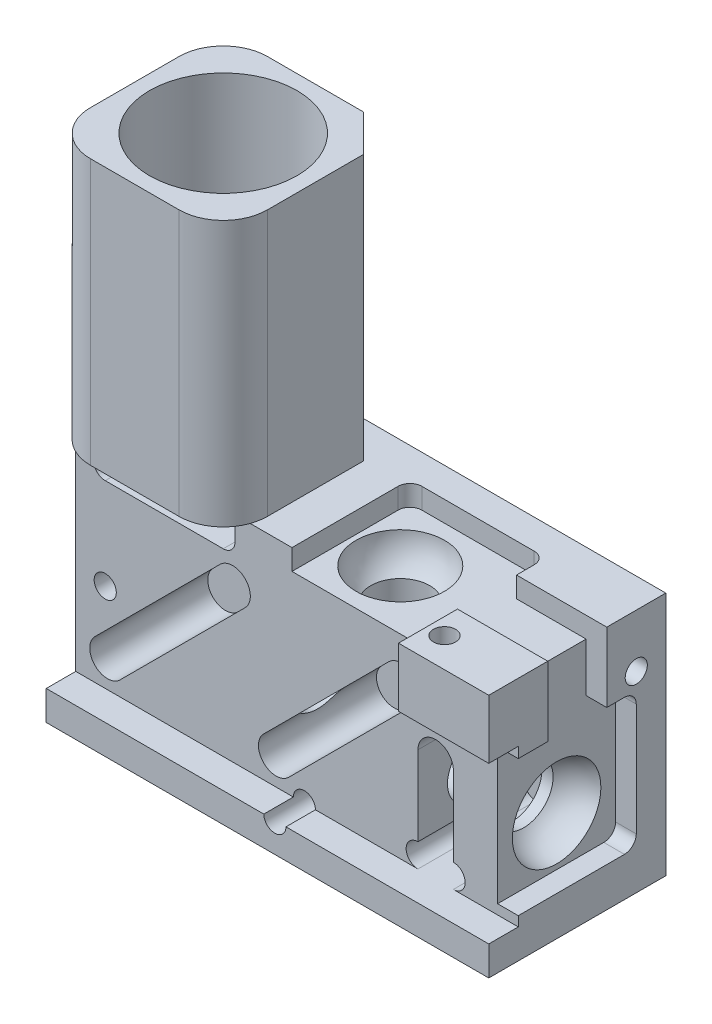
from build123d import *

# Parameters (mm, degrees)
SKETCH1_W                        = 15
SKETCH1_H                        = 6
MAIN_BODY_EXT_DEPTH              = 8.3
EMISSION_PATH_EXT_DEPTH          = 9
SKETCH3_R                        = 1.25
EMISSION_AND_GRIN_CUT_DEPTH      = 20.092931
SKETCH4_R                        = 1
DRUM_LENS_CUT_DEPTH              = 13
SKETCH41_R                       = 1
ADDTL_LIGHT_SOURCE_DEPTH         = 5
SKETCH5_W                        = 15
SKETCH5_H                        = 7.3
FILTERCOVER_CUT1_DEPTH           = 1
TOP_LED_SCREW_W                  = 3.06
TOP_LED_SCREW_H                  = 2
BOSS_EXTRUDE1_DEPTH              = 1
FILTERSET_CUT2_DEPTH             = 4
SKETCH10_R                       = 2.5
EMISSION_LENS_CUT_DEPTH          = 8.5
SKETCH15_R                       = 0.795
MAGNETS_CUT_DEPTH                = 0.9
SCREW_HOLES_CUT_DEPTH            = 20.507434
SCREW_HOLES_CUT_DEPTH_BACK       = 2.5
SKETCH18_R                       = 0.375
EXTERNAL_FILLET_1_R              = 1.5
VERTICAL_PATH_CUT_DEPTH          = 14.011149
VERTICAL_PATH_CUT_DEPTH_BACK     = 4
SKETCH28_R                       = 1.5
CUT_EXTRUDE_ORIGINAL_LIGHT_DEPTH = 0.7
CUT_EXTRUDE_ADDTL_LIGHT_DEPTH    = 0.7
SKETCH29_R                       = 0.375
SIDE_LED_SCREW_DEPTH             = 2.5
SKETCH32_W                       = 2
SKETCH32_H                       = 2.36
SIDE_WIRE_SLOT_CUT_DEPTH         = 0.7
SKETCH45_W                       = 2.36
SKETCH45_H                       = 2
TOP_LED_SLOT_DEPTH               = 0.7
CUT_EXTRUDE16_DEPTH              = 9
CUT_EXTRUDE17_REACH              = 13.945
SKETCH37_R                       = 2
SKETCH51_R                       = 0.375
TOP_LE_SCREW_DEPTH               = 2.1
NOTCH_EXTRUDE_DEPTH              = 2


with BuildPart() as part:
    # Sketch1 → Main Body Ext (new body)
    with BuildSketch(Plane(origin=(0, 0, 0), x_dir=(1, 0, 0), z_dir=(0, 1, 0))):
        Rectangle(SKETCH1_W, SKETCH1_H)
    extrude(amount=MAIN_BODY_EXT_DEPTH)

    # Sketch8 → Emission Path Ext (add)
    with BuildSketch(Plane(origin=(0, 8.3, 0), x_dir=(1, 0, 0), z_dir=(0, 1, 0))):
        Polygon((-2.75, 3), (-1.5, 1.75), (-1.5, -3), (-7.5, -3), (-7.5, 3), align=None)
    extrude(amount=EMISSION_PATH_EXT_DEPTH)

    # Sketch3 → Emission and Grin Cut (cut, through all)
    with BuildSketch(Plane.XZ):
        with Locations(Location((-4.5, 0, 0), (0, 0, 270))):
            Circle(SKETCH3_R)
    extrude(amount=-EMISSION_AND_GRIN_CUT_DEPTH, mode=Mode.SUBTRACT)

    # Sketch4 → Drum Lens Cut (cut)
    with BuildSketch(Plane(origin=(7.5, 0, 0), x_dir=(0, 0, -1), z_dir=(1, 0, 0))):
        with Locations((0, 3)):
            Circle(SKETCH4_R)
    extrude(amount=-DRUM_LENS_CUT_DEPTH, mode=Mode.SUBTRACT)

    # Sketch41 → Addtl Light Source (cut)
    with BuildSketch(Plane(origin=(0, 8.3, 0), x_dir=(1, 0, 0), z_dir=(0, 1, 0))):
        with Locations(Location((1.5, 0, 0), (0, 0, 270))):
            Circle(SKETCH41_R)
    extrude(amount=-ADDTL_LIGHT_SOURCE_DEPTH, mode=Mode.SUBTRACT)

    # Sketch5 → FilterCover Cut1 (cut)
    with BuildSketch(Plane.XY.offset(3)):
        with Locations((0, 4.65)):
            Rectangle(SKETCH5_W, SKETCH5_H)
    extrude(amount=-FILTERCOVER_CUT1_DEPTH, mode=Mode.SUBTRACT)

    # Top-LED-Screw → Boss-Extrude1 (add)
    with BuildSketch(Plane.XY.offset(2)):
        with Locations((5.97, 7.3)):
            Rectangle(TOP_LED_SCREW_W, TOP_LED_SCREW_H)
    extrude(amount=BOSS_EXTRUDE1_DEPTH)

    # Sketch6 → FilterSet Cut2 (cut)
    with BuildSketch(Plane.XY.offset(2)):
        with BuildLine():
            Line((5.3, 4.5), (5.3, 1.8))
            ThreePointArc((5.3, 1.8), (5.7, 1.4), (5.3, 1))
            Line((5.3, 1), (4.1, 1))
            ThreePointArc((4.1, 1), (3.7, 1.4), (4.1, 1.8))
            Line((4.1, 1.8), (4.1, 4.5))
            ThreePointArc((4.1, 4.5), (4.7, 5.1), (5.3, 4.5))
        make_face()
        with BuildLine():
            Line((-6.9, 7.9), (-6.9, 7.5))
            ThreePointArc((-6.9, 7.5), (-6.782843, 7.217157), (-6.5, 7.1))
            Line((-6.5, 7.1), (-2.5, 7.1))
            ThreePointArc((-2.5, 7.1), (-2.217157, 7.217157), (-2.1, 7.5))
            Line((-2.1, 7.5), (-2.1, 7.9))
            ThreePointArc((-2.1, 7.9), (-2.217157, 8.182843), (-2.5, 8.3))
            Line((-2.5, 8.3), (-6.5, 8.3))
            ThreePointArc((-6.5, 8.3), (-6.782843, 8.182843), (-6.9, 7.9))
        make_face()
        with BuildLine():
            Line((-2.605887, 6.591169), (-6.848528, 2.348528))
            ThreePointArc((-6.848528, 2.348528), (-6.848528, 1.5), (-6, 1.5))
            Line((-6, 1.5), (-1.757359, 5.742641))
            ThreePointArc((-1.757359, 5.742641), (-1.757359, 6.591169), (-2.605887, 6.591169))
        make_face()
        with BuildLine():
            Line((3.112092, 6.591169), (-1.130548, 2.348528))
            ThreePointArc((-1.130548, 2.348528), (-1.130548, 1.5), (-0.28202, 1.5))
            Line((-0.28202, 1.5), (3.96062, 5.742641))
            ThreePointArc((3.96062, 5.742641), (3.96062, 6.591169), (3.112092, 6.591169))
        make_face()
    extrude(amount=-FILTERSET_CUT2_DEPTH, mode=Mode.SUBTRACT)

    # Sketch10 → Emission Lens Cut (cut)
    with BuildSketch(Plane(origin=(0, 17.3, 0), x_dir=(1, 0, 0), z_dir=(0, 1, 0))):
        with Locations(Location((-4.5, 0, 0), (0, 0, 270))):
            Circle(SKETCH10_R)
    extrude(amount=-EMISSION_LENS_CUT_DEPTH, mode=Mode.SUBTRACT)

    # Sketch15 → Magnets Cut (cut)
    with BuildSketch(Plane.XZ):
        with Locations(Location((-6.25, -1.875, 0), (0, 0, 270))):
            Circle(SKETCH15_R)
        with Locations(Location((-6.25, 1.875, 0), (0, 0, 270))):
            Circle(SKETCH15_R)
        with Locations(Location((-1.5, 0, 0), (0, 0, 270))):
            Circle(SKETCH15_R)
    extrude(amount=-MAGNETS_CUT_DEPTH, mode=Mode.SUBTRACT)

    # Sketch18 → Screw Holes Cut (cut, two sides: drawn at the far end of the back side and taken through both)
    with BuildSketch(Plane.XY.offset(2).offset(-SCREW_HOLES_CUT_DEPTH_BACK)):
        with Locations(Location((-6.5, 4, 0), (0, 0, 180))):
            Circle(SKETCH18_R)
        with Locations(Location((6, 5.8, 0), (0, 0, 180))):
            Circle(SKETCH18_R)
        with Locations((0.25, 1)):
            Circle(SKETCH18_R)
    extrude(amount=SCREW_HOLES_CUT_DEPTH + SCREW_HOLES_CUT_DEPTH_BACK, mode=Mode.SUBTRACT)

    # External Fillet 1
    # the kernel refuses this fillet: 1.5 mm, written as the material it takes off along each edge
    with BuildSketch(Plane(origin=(-7.5, -3.75, -3), x_dir=(1, 0, 0), z_dir=(0, 1, 0))) as external_fillet_1_piece_1:
        with BuildLine():
            CenterArc((EXTERNAL_FILLET_1_R, -EXTERNAL_FILLET_1_R), EXTERNAL_FILLET_1_R, 90, 90)
            Line((0, -EXTERNAL_FILLET_1_R), (0, 0))
            Line((0, 0), (EXTERNAL_FILLET_1_R, 0))
        make_face()
    extrude(amount=24.8, mode=Mode.SUBTRACT)
    with BuildSketch(Plane(origin=(-1.5, 8.3, 3), x_dir=(0, 0, -1), z_dir=(0, 1, 0))) as external_fillet_1_piece_2:
        with BuildLine():
            CenterArc((EXTERNAL_FILLET_1_R, EXTERNAL_FILLET_1_R), EXTERNAL_FILLET_1_R, 180, 90)
            Line((0, EXTERNAL_FILLET_1_R), (0, 0))
            Line((0, 0), (EXTERNAL_FILLET_1_R, 0))
        make_face()
    extrude(amount=12.75, mode=Mode.SUBTRACT)

    # Sketch28 → Vertical-Path-Cut (cut, two sides: drawn at the far end of the back side and taken through both)
    with BuildSketch(Plane(origin=(0, 7.1, 0), x_dir=(1, 0, 0), z_dir=(0, 1, 0)).offset(-VERTICAL_PATH_CUT_DEPTH_BACK)):
        with Locations(Location((-4.5, 0, 0), (0, 0, 180))):
            Circle(SKETCH28_R)
    extrude(amount=VERTICAL_PATH_CUT_DEPTH + VERTICAL_PATH_CUT_DEPTH_BACK, mode=Mode.SUBTRACT)

    # Sketch12 → Cut-Extrude Original Light (cut)
    with BuildSketch(Plane(origin=(7.5, 0, 0), x_dir=(0, 0, -1), z_dir=(1, 0, 0))):
        with BuildLine():
            Line((1.6, 5.94), (-1.6, 5.94))
            Line((-1.6, 5.94), (-2, 5.94))
            Line((-2, 5.94), (-2, 1.33))
            Line((-2, 1.33), (1.6, 1.33))
            ThreePointArc((1.6, 1.33), (1.882843, 1.447157), (2, 1.73))
            Line((2, 1.73), (2, 5.54))
            ThreePointArc((2, 5.54), (1.882843, 5.822843), (1.6, 5.94))
        make_face()
    extrude(amount=-CUT_EXTRUDE_ORIGINAL_LIGHT_DEPTH, mode=Mode.SUBTRACT)

    # Sketch44 → Cut-Extrude Addtl Light (cut)
    with BuildSketch(Plane(origin=(0, 8.3, 0), x_dir=(1, 0, 0), z_dir=(0, 1, 0))):
        with BuildLine():
            Line((-0.17, -2), (4.44, -2))
            Line((4.44, -2), (4.44, 1.6))
            ThreePointArc((4.44, 1.6), (4.322843, 1.882843), (4.04, 2))
            Line((4.04, 2), (0.23, 2))
            ThreePointArc((0.23, 2), (-0.052843, 1.882843), (-0.17, 1.6))
            Line((-0.17, 1.6), (-0.17, -2))
        make_face()
    extrude(amount=-CUT_EXTRUDE_ADDTL_LIGHT_DEPTH, mode=Mode.SUBTRACT)

    # Sketch29 → Side-LED-Screw (cut)
    with BuildSketch(Plane(origin=(7.5, 0, 0), x_dir=(0, 0, -1), z_dir=(1, 0, 0))):
        with Locations((2, 6.5)):
            Circle(SKETCH29_R)
    extrude(amount=-SIDE_LED_SCREW_DEPTH, mode=Mode.SUBTRACT)

    # Sketch32 → Side-Wire-Slot-Cut (cut)
    with BuildSketch(Plane(origin=(7.5, 0, 0), x_dir=(0, 0, -1), z_dir=(1, 0, 0))):
        with Locations((0, 7.12)):
            Rectangle(SKETCH32_W, SKETCH32_H)
    extrude(amount=-SIDE_WIRE_SLOT_CUT_DEPTH, mode=Mode.SUBTRACT)

    # Sketch45 → Top-LED-slot (cut)
    with BuildSketch(Plane(origin=(0, 8.3, 0), x_dir=(1, 0, 0), z_dir=(0, 1, 0))):
        with Locations((5.62, 0)):
            Rectangle(SKETCH45_W, SKETCH45_H)
    extrude(amount=-TOP_LED_SLOT_DEPTH, mode=Mode.SUBTRACT)

    # Sketch33 → Side-BallLens_Cut (revolve, cut)
    with BuildSketch(Plane.XY, mode=Mode.PRIVATE) as side_balllens_cut_sk:
        with BuildLine():
            Line((6.8, 3), (5.3, 3))
            ThreePointArc((5.3, 3), (5.73934, 4.06066), (6.8, 4.5))
            Line((6.8, 4.5), (6.8, 3))
        make_face()
    revolve(side_balllens_cut_sk.sketch.rotate(Axis((6.8, 3, 0), (-1, 0, 0)), 84.26086), axis=Axis((6.8, 3, 0), (-1, 0, 0)), mode=Mode.SUBTRACT)

    # Sketch47 → Top-BallLens_Cut (revolve, cut)
    with BuildSketch(Plane(origin=(1.5, 0, 0), x_dir=(0, 0, -1), z_dir=(1, 0, 0))):
        with BuildLine():
            Line((-1.5, 7.6), (0, 7.6))
            Line((0, 7.6), (0, 6.137287))
            ThreePointArc((0, 6.137287), (-1.04756, 6.563498), (-1.5, 7.6))
        make_face()
    revolve(axis=Axis((1.5, 7.6, 0), (0, -1, 0)), mode=Mode.SUBTRACT)

    # Sketch36 → Cut-Extrude16 (cut)
    with BuildSketch(Plane(origin=(0, 17.3, 0), x_dir=(1, 0, 0), z_dir=(0, 1, 0))):
        with BuildLine():
            Line((-7.5, -1.5), (-7.5, -3))
            Line((-7.5, -3), (-6, -3))
            ThreePointArc((-6, -3), (-7.06066, -2.56066), (-7.5, -1.5))
        make_face()
    extrude(amount=-CUT_EXTRUDE16_DEPTH, mode=Mode.SUBTRACT)

    # Sketch37 → Cut-Extrude17 (cut, up to next)
    with BuildSketch(Plane(origin=(0, 8.8, 0), x_dir=(1, 0, 0), z_dir=(0, 1, 0)), mode=Mode.PRIVATE) as cut_extrude17_sk1:
        with Locations(Location((-4.5, 0, 0), (0, 0, 180))):
            Circle(SKETCH37_R)
    cut_extrude17_tool1 = extrude(cut_extrude17_sk1.sketch, amount=-CUT_EXTRUDE17_REACH, mode=Mode.PRIVATE) & part.part
    add(cut_extrude17_tool1.solids().sort_by_distance((-4.5, 8.8, 0))[0], mode=Mode.SUBTRACT)

    # Sketch51 → Top-LE-Screw (cut)
    with BuildSketch(Plane(origin=(0, 8.3, 0), x_dir=(1, 0, 0), z_dir=(0, 1, 0))):
        with Locations(Location((5, -2, 0), (0, 0, 270))):
            Circle(SKETCH51_R)
    extrude(amount=-TOP_LE_SCREW_DEPTH, mode=Mode.SUBTRACT)

    # Notch → Notch-Extrude (cut)
    with BuildSketch(Plane.XZ):
        Polygon((3.12111, -1.8476), (1.684933, -1.8476), (1.684933, -3), (4.84971, -3), align=None)
        Polygon((1.684933, -3), (1.684933, -1.8476), (0.916667, -3), align=None)
    extrude(amount=-NOTCH_EXTRUDE_DEPTH, mode=Mode.SUBTRACT)


solid = part.part
